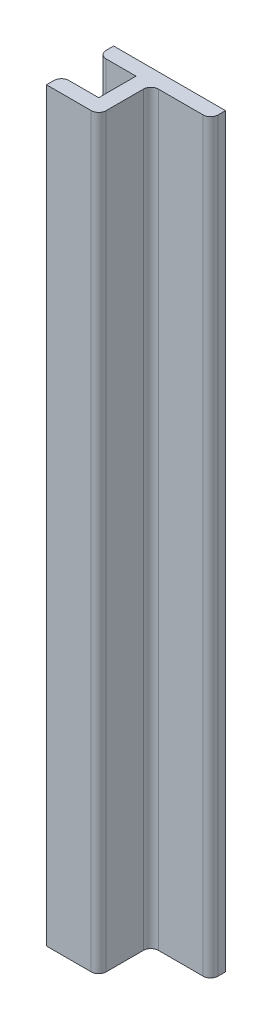
from build123d import *

# Parameters (mm, degrees)
BOSS_EXTRUDE1_DEPTH = 100
FILLET1_R           = 1


with BuildPart() as part:
    # Sketch1 → Boss-Extrude1 (new body)
    with BuildSketch(Plane(origin=(0, 0, 0), x_dir=(1, 0, 0), z_dir=(0, 1, 0))):
        Polygon((0, 0), (15, 0), (15, -2), (7, -2), (7, -9), (0, -9), (0, -7), (5, -7), (5, -2), (0, -2), align=None)
    extrude(amount=BOSS_EXTRUDE1_DEPTH)

    # Fillet1
    fillet1_edges = [part.edges().sort_by_distance(p)[0] for p in [
        (0, 50, 7),
        (0, 50, 2),
        (7, 50, 9),
        (7, 50, 2),
        (15, 50, 2),
    ]]
    fillet(fillet1_edges, radius=FILLET1_R)


solid = part.part
